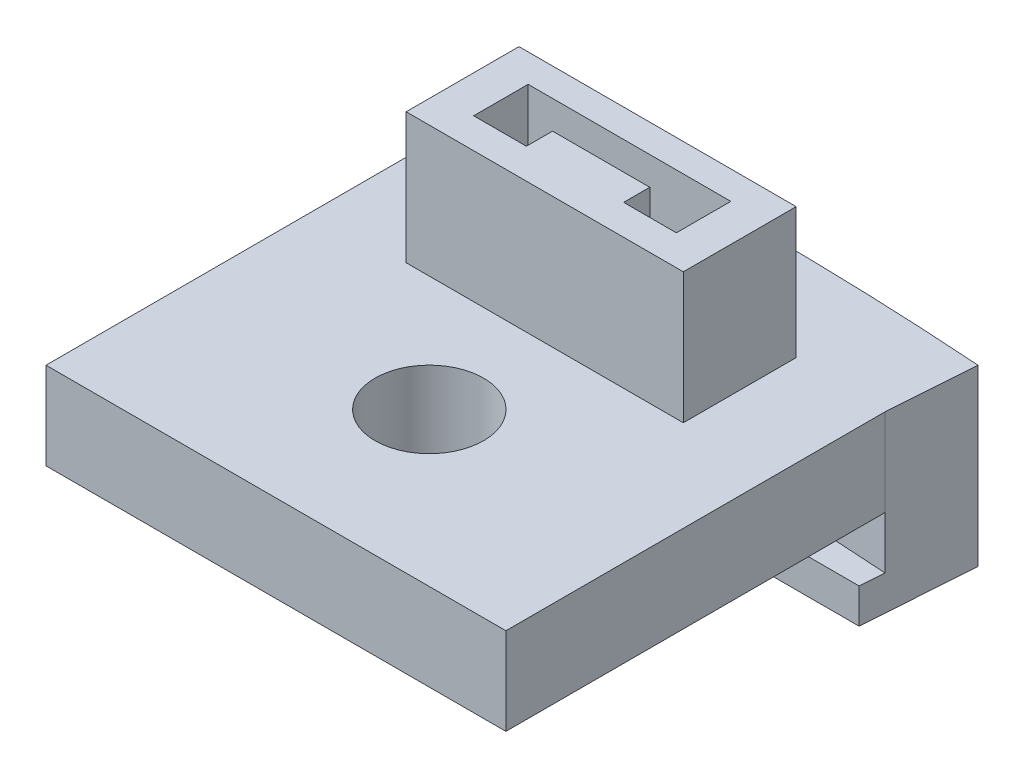
from build123d import *

# Parameters (mm, degrees)
SKETCH1_W           = 11.811
SKETCH1_H           = 3.175
SKETCH1_R           = 3.1623
BOSS_EXTRUDE1_DEPTH = 5.08
SKETCH1_3_W         = 16.150142566
SKETCH1_3_H         = 6.574737844
BOSS_EXTRUDE2_DEPTH = 12.7
BOSS_EXTRUDE3_START = -5.08
BOSS_EXTRUDE3_DEPTH = 5.08
BOSS_EXTRUDE5_DEPTH = 2.032
BOSS_EXTRUDE6_START = -1.27
SKETCH1_6_R         = 5.53085
SKETCH1_6_R_2       = 3.1623
BOSS_EXTRUDE6_DEPTH = 1.27


with BuildPart() as part:
    # Sketch1 → Boss-Extrude1 (new body)
    with BuildSketch(Plane(origin=(0, 0, 0), x_dir=(1, 0, 0), z_dir=(0, 1, 0))):
        with BuildLine():
            ThreePointArc((13.753578899, 4.597841674), (0, 5.078127233), (-13.753578899, 4.597841674))
            Line((-13.753578899, 4.597841674), (-13.39934665, -0.467915496))
            Line((-13.39934665, -0.467915496), (-13.39934665, -22.557024998))
            Line((-13.39934665, -22.557024998), (13.39934665, -22.557024998))
            Line((13.39934665, -22.557024998), (13.39934665, -0.467915496))
            Line((13.39934665, -0.467915496), (13.753578899, 4.597841674))
        make_face()
        with Locations((0, -3.5433)):
            Rectangle(SKETCH1_W, SKETCH1_H, mode=Mode.SUBTRACT)
        with Locations((0, -13.62075)):
            Circle(SKETCH1_R, mode=Mode.SUBTRACT)
    extrude(amount=BOSS_EXTRUDE1_DEPTH)

    # Sketch1<3> → Boss-Extrude2 (add)
    with BuildSketch(Plane(origin=(0, 0, 0), x_dir=(1, 0, 0), z_dir=(0, 1, 0))):
        with Locations((0, -3.6068)):
            Rectangle(SKETCH1_3_W, SKETCH1_3_H)
        Polygon((-2.8321, -3.6068), (-2.8321, -5.1308), (-5.9055, -5.1308), (-5.9055, -1.9558), (5.9055, -1.9558), (5.9055, -5.1308), (2.8321, -5.1308), (2.8321, -3.6068), align=None, mode=Mode.SUBTRACT)
    extrude(amount=BOSS_EXTRUDE2_DEPTH)

    # Sketch1<4> → Boss-Extrude3 (add)
    with BuildSketch(Plane(origin=(0, 0, 0), x_dir=(1, 0, 0), z_dir=(0, 1, 0)).offset(BOSS_EXTRUDE3_START)):
        with BuildLine():
            ThreePointArc((13.753578899, 4.597841674), (0, 5.078127233), (-13.753578899, 4.597841674))
            Line((-13.753578899, 4.597841674), (-13.39934665, -0.467915496))
            ThreePointArc((-13.39934665, -0.467915496), (-6.703757073, -0.117014515), (0, 0))
            ThreePointArc((0, 0), (6.703757073, -0.117014515), (13.39934665, -0.467915496))
            Line((13.39934665, -0.467915496), (13.753578899, 4.597841674))
        make_face()
    extrude(amount=BOSS_EXTRUDE3_DEPTH)

    # Sketch2 → Boss-Extrude5 (add)
    with BuildSketch(Plane.XZ.offset(5.08)):
        Polygon((-13.753578899, -4.597841674), (-13.39934665, 0.467915496), (-13.300671129, 1.879041191), (13.300671129, 1.879041191), (13.39934665, 0.467915496), (13.753578899, -4.597841674), align=None)
    extrude(amount=-BOSS_EXTRUDE5_DEPTH)

    # Sketch1<6> → Boss-Extrude6 (add)
    with BuildSketch(Plane(origin=(0, 0, 0), x_dir=(1, 0, 0), z_dir=(0, 1, 0)).offset(BOSS_EXTRUDE6_START)):
        with Locations((0, -13.62075)):
            Circle(SKETCH1_6_R)
        with Locations((0, -13.62075)):
            Circle(SKETCH1_6_R_2, mode=Mode.SUBTRACT)
    extrude(amount=BOSS_EXTRUDE6_DEPTH)


solid = part.part
